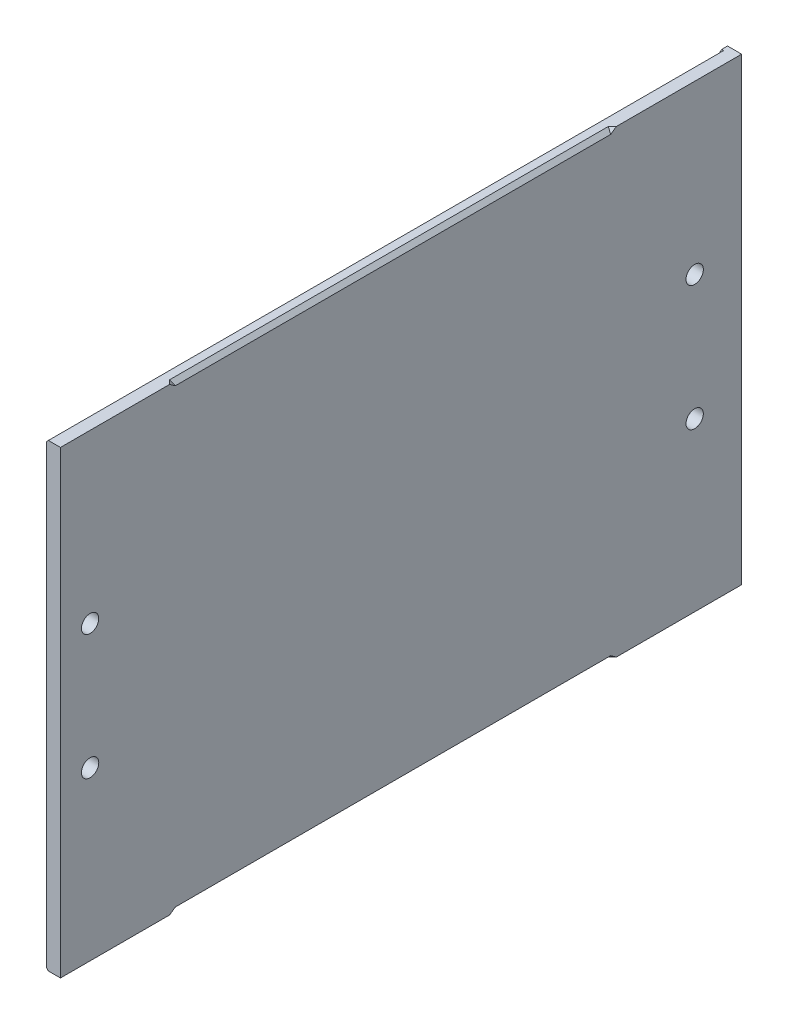
from build123d import *

# Parameters (mm, degrees)
SKETCH1_W                = 134
SKETCH1_H                = 57
BOSS_EXTRUDE1_DEPTH      = 250
SKETCH2_W                = 115
SKETCH2_H                = 53.5
CUT_EXTRUDE1_DEPTH       = 246.5
SKETCH3_W                = 115
SKETCH3_H                = 194
CUT_EXTRUDE2_DEPTH       = 3.5
SKETCH4_W                = 6
SKETCH4_H                = 120
CUT_EXTRUDE3_DEPTH       = 290.318163965
CHAMFER1_SIZE            = 6
SKETCH5_R                = 2.15
CUT_EXTRUDE4_DEPTH       = 134
SKETCH6_W                = 25
SKETCH6_H                = 4.5
BOSS_EXTRUDE2_DEPTH      = 115
SKETCH7_R                = 3.65
CUT_EXTRUDE5_DEPTH       = 3.6
CUT_EXTRUDE6_START       = -3.6
SKETCH8_R                = 3.65
CUT_EXTRUDE6_DEPTH       = 3.6
CHAMFER1_OF_MIRROR1_SIZE = 6
SKETCH9_R                = 1.65
CUT_EXTRUDE7_DEPTH       = 25
CHAMFER3_SIZE            = 0.5
CUT_EXTRUDE9_DEPTH       = 306.69919856
CHAMFER4_SIZE            = 0.5
SKETCH12_W               = 0.5
SKETCH12_H               = 2
BOSS_EXTRUDE3_DEPTH      = 114
CHAMFER5_SIZE            = 0.5


# Some blends are built 0.0001 mm under size
with BuildPart() as part:
    # Sketch1 → Boss-Extrude1 (new body)
    with BuildSketch(Plane.XY):
        with Locations((67, 28.5)):
            Rectangle(SKETCH1_W, SKETCH1_H)
    boss_extrude1 = extrude(amount=BOSS_EXTRUDE1_DEPTH)

    # Sketch2 → Cut-Extrude1 (cut)
    with BuildSketch(Plane.XY.offset(250)):
        with Locations((67, 26.75)):
            Rectangle(SKETCH2_W, SKETCH2_H)
    cut_extrude1 = extrude(amount=-CUT_EXTRUDE1_DEPTH, mode=Mode.SUBTRACT)

    # Sketch3 → Cut-Extrude2 (cut)
    with BuildSketch(Plane(origin=(0, 57, 0), x_dir=(1, 0, 0), z_dir=(0, 1, 0))):
        with Locations((67, -153)):
            Rectangle(SKETCH3_W, SKETCH3_H)
    cut_extrude2 = extrude(amount=-CUT_EXTRUDE2_DEPTH, mode=Mode.SUBTRACT)

    # Sketch4 → Cut-Extrude3 (cut, through all)
    with BuildSketch(Plane.XZ):
        with Locations((3, 142.5)):
            Rectangle(SKETCH4_W, SKETCH4_H)
        with Locations((131, 142.5)):
            Rectangle(SKETCH4_W, SKETCH4_H)
    cut_extrude3 = extrude(amount=-CUT_EXTRUDE3_DEPTH, mode=Mode.SUBTRACT)

    # Chamfer1
    chamfer1_edges = [part.edges().sort_by_distance(p)[0] for p in [
        (6, 28.5, 202.5),
        (6, 28.5, 82.5),
        (128, 28.5, 82.5),
        (128, 28.5, 202.5),
    ]]
    chamfer(chamfer1_edges, length=CHAMFER1_SIZE - 0.0001)  # a hair under: the kernel refuses the full size

    # Sketch5 → Cut-Extrude4 (cut)
    with BuildSketch(Plane(origin=(134, 0, 0), x_dir=(0, 0, -1), z_dir=(1, 0, 0))):
        with Locations((-217.65, 15.5)):
            Circle(SKETCH5_R)
        with Locations((-67.65, 15.5)):
            Circle(SKETCH5_R)
    cut_extrude4 = extrude(amount=-CUT_EXTRUDE4_DEPTH, mode=Mode.SUBTRACT)

    # Sketch6 → Boss-Extrude2 (add)
    with BuildSketch(Plane(origin=(9.5, 0, 0), x_dir=(0, 0, -1), z_dir=(1, 0, 0))):
        with Locations((-237.5, 2.25)):
            Rectangle(SKETCH6_W, SKETCH6_H)
    boss_extrude2 = extrude(amount=BOSS_EXTRUDE2_DEPTH)

    # Sketch7 → Cut-Extrude5 (cut)
    with BuildSketch(Plane(origin=(134, 0, 0), x_dir=(0, 0, -1), z_dir=(1, 0, 0))):
        with Locations((-217.65, 15.5)):
            Circle(SKETCH7_R)
        with Locations((-67.65, 15.5)):
            Circle(SKETCH7_R)
    cut_extrude5 = extrude(amount=-CUT_EXTRUDE5_DEPTH, mode=Mode.SUBTRACT)

    # Sketch8 → Cut-Extrude6 (cut)
    with BuildSketch(Plane.ZY.offset(CUT_EXTRUDE6_START)):
        with Locations(Location((217.65, 15.5, 0), (0, 0, 180))):
            Circle(SKETCH8_R)
        with Locations(Location((67.65, 15.5, 0), (0, 0, 180))):
            Circle(SKETCH8_R)
    cut_extrude6 = extrude(amount=CUT_EXTRUDE6_DEPTH, mode=Mode.SUBTRACT)


with BuildPart() as mirror1_1:
    # Mirror1: Boss-Extrude1 across plane
    add(boss_extrude1.mirror(Plane.ZX))

    # Mirror1 2: Cut-Extrude1, Cut-Extrude2, Cut-Extrude3, Cut-Extrude4 across plane
    add(cut_extrude1.mirror(Plane.ZX), mode=Mode.SUBTRACT)
    add(cut_extrude2.mirror(Plane.ZX), mode=Mode.SUBTRACT)
    add(cut_extrude3.mirror(Plane.ZX), mode=Mode.SUBTRACT)
    add(cut_extrude4.mirror(Plane.ZX), mode=Mode.SUBTRACT)

    # Mirror1 4: Cut-Extrude5, Cut-Extrude6 across plane
    add(cut_extrude5.mirror(Plane.ZX), mode=Mode.SUBTRACT)
    add(cut_extrude6.mirror(Plane.ZX), mode=Mode.SUBTRACT)

    # Chamfer1 of Mirror1
    chamfer1_of_mirror1_edges = [mirror1_1.edges().sort_by_distance(p)[0] for p in [
        (6, -28.5, 202.5),
        (6, -28.5, 82.5),
        (128, -28.5, 82.5),
        (128, -28.5, 202.5),
    ]]
    chamfer(chamfer1_of_mirror1_edges, length=CHAMFER1_OF_MIRROR1_SIZE - 0.0001)  # a hair under: the kernel refuses the full size


with BuildPart() as mirror1_3_1:
    # Mirror1 3: Boss-Extrude2 across plane
    add(boss_extrude2.mirror(Plane.ZX))


with BuildPart() as part_1:
    add(part.part)

    # Mirror1 united with what the copies touc: union Mirror1_1, Mirror1 3_1
    add(mirror1_1.part)
    add(mirror1_3_1.part)

    # Sketch9 → Cut-Extrude7 (cut)
    with BuildSketch(Plane.XY.offset(250)):
        with Locations((25, 0)):
            Circle(SKETCH9_R)
        with Locations((109, 0)):
            Circle(SKETCH9_R)
    extrude(amount=-CUT_EXTRUDE7_DEPTH, mode=Mode.SUBTRACT)

    # Chamfer2
    # the kernel refuses this chamfer: 1 mm, written as the material it takes off along each edge
    with BuildSketch(Plane(origin=(133.333333333, -56.333333333, 0.666666667), x_dir=(-0.7071067811865475, -0.7071067811865475, 0), z_dir=(0.5773502691896257, -0.5773502691896258, -0.5773502691896258))) as chamfer2_piece_1:
        Polygon((-0.707106781, -0.40824829), (0.707106781, -0.40824829), (0, 0.816496581), align=None)
    extrude(amount=1.270170592, mode=Mode.SUBTRACT)
    with BuildSketch(Plane(origin=(0.666666667, -56.333333333, 0.666666667), x_dir=(0.7071067811865475, -0.7071067811865475, 0), z_dir=(-0.5773502691896258, -0.5773502691896258, -0.5773502691896258)), Plane(origin=(133.333333333, 56.333333333, 0.666666667), x_dir=(-0.7071067811865475, 0.7071067811865475, 0), z_dir=(0.5773502691896257, 0.5773502691896258, -0.5773502691896258)), Plane(origin=(0.666666667, 56.333333333, 0.666666667), x_dir=(-0.7071067811865475, -0.7071067811865475, 0), z_dir=(-0.5773502691896257, 0.5773502691896258, -0.5773502691896257))) as chamfer2_piece_2:
        Polygon((-0.707106781, 0.40824829), (0.707106781, 0.40824829), (0, -0.816496581), align=None)
    extrude(amount=1.270170592, mode=Mode.SUBTRACT)
    with BuildSketch(Plane(origin=(0, -57, 199.928317012), x_dir=(0.9996219169112968, -0.02749587661058908, 0), z_dir=(0, 0, 1)), Plane(origin=(134, 57, 199.928317012), x_dir=(-0.9996219169112968, 0.027495876610589196, 0), z_dir=(0, 0, 1))) as chamfer2_piece_3:
        with BuildLine():
            Line((1.028673195, 0), (-0.056547155, 1.027117794))
            Line((-0.056547155, 1.027117794), (-0.076539593, 1.026567876))
            ThreePointArc((-0.076539593, 1.026567876), (-0.034129227, 0.51339783), (-0.019992438, -0.000549918))
            Line((-0.019992438, -0.000549918), (0.000549918, -0.019992438))
            ThreePointArc((0.000549918, -0.019992438), (0.514497665, -0.00585565), (1.029223113, -0.019992438))
            Line((1.029223113, -0.019992438), (1.028673195, 0))
        make_face()
    extrude(amount=52.643365976, mode=Mode.SUBTRACT)
    with BuildSketch(Plane(origin=(134, -57, 199.928317012), x_dir=(-0.9996219169112968, -0.027495876610589196, 0), z_dir=(0, 0, 1)), Plane(origin=(0, 57, 199.928317012), x_dir=(0.9996219169112968, 0.02749587661058908, 0), z_dir=(0, 0, 1))) as chamfer2_piece_4:
        with BuildLine():
            Line((1.028673195, 0), (-0.056547155, -1.027117794))
            Line((-0.056547155, -1.027117794), (-0.076539593, -1.026567876))
            ThreePointArc((-0.076539593, -1.026567876), (-0.034129227, -0.51339783), (-0.019992438, 0.000549918))
            Line((-0.019992438, 0.000549918), (0.000549918, 0.019992438))
            ThreePointArc((0.000549918, 0.019992438), (0.514497665, 0.00585565), (1.029223113, 0.019992438))
            Line((1.029223113, 0.019992438), (1.028673195, 0))
        make_face()
    extrude(amount=52.643365976, mode=Mode.SUBTRACT)
    with BuildSketch(Plane(origin=(136.571682988, -57, 0), x_dir=(0, -0.02749587661058908, 0.9996219169112968), z_dir=(-1, 0, 0))) as chamfer2_piece_5:
        with BuildLine():
            Line((1.028673195, 0), (-0.056547155, 1.027117794))
            Line((-0.056547155, 1.027117794), (-0.076539593, 1.026567876))
            ThreePointArc((-0.076539593, 1.026567876), (-0.034129227, 0.51339783), (-0.019992438, -0.000549918))
            Line((-0.019992438, -0.000549918), (0.000549918, -0.019992438))
            ThreePointArc((0.000549918, -0.019992438), (0.514497665, -0.00585565), (1.029223113, -0.019992438))
            Line((1.029223113, -0.019992438), (1.028673195, 0))
        make_face()
    extrude(amount=139.143365976, mode=Mode.SUBTRACT)
    with BuildSketch(Plane(origin=(134, -57, -2.571682988), x_dir=(0.027495876610582105, 0.999621916911297, 0), z_dir=(0, 0, 1)), Plane(origin=(0, -57, -2.571682988), x_dir=(0.9996219169112968, -0.02749587661058908, 0), z_dir=(0, 0, 1))) as chamfer2_piece_6:
        with BuildLine():
            Line((1.028673195, 0), (-0.056547155, 1.027117794))
            Line((-0.056547155, 1.027117794), (-0.076539593, 1.026567876))
            ThreePointArc((-0.076539593, 1.026567876), (-0.034129227, 0.51339783), (-0.019992438, -0.000549918))
            Line((-0.019992438, -0.000549918), (0.000549918, -0.019992438))
            ThreePointArc((0.000549918, -0.019992438), (0.514497665, -0.00585565), (1.029223113, -0.019992438))
            Line((1.029223113, -0.019992438), (1.028673195, 0))
        make_face()
    extrude(amount=87.643365976, mode=Mode.SUBTRACT)
    with BuildSketch(Plane(origin=(6, -57, 85.928217012), x_dir=(0.9996219169112968, -0.027495876610589075, 0), z_dir=(0, 0, 1))) as chamfer2_piece_7_section:
        with BuildLine():
            Line((1.028673195, 0), (-0.056547155, 1.027117794))
            Line((-0.056547155, 1.027117794), (-0.076539593, 1.026567876))
            ThreePointArc((-0.076539593, 1.026567876), (-0.034129227, 0.51339783), (-0.019992438, -0.000549918))
            Line((-0.019992438, -0.000549918), (0.000549918, -0.019992438))
            ThreePointArc((0.000549918, -0.019992438), (0.514497665, -0.00585565), (1.029223113, -0.019992438))
            Line((1.029223113, -0.019992438), (1.028673195, 0))
        make_face()
    chamfer2_piece_7 = extrude(amount=113.143565976, mode=Mode.PRIVATE)
    chamfer2_piece_7 = split(chamfer2_piece_7, bisect_by=Plane(origin=(33.164355215, -56.669573831, 115.664255215), z_dir=(-0.7071067811865475, 0, 0.7071067811865477)), keep=Keep.TOP, mode=Mode.PRIVATE)
    chamfer2_piece_7 = split(chamfer2_piece_7, bisect_by=Plane(origin=(33.164355215, -56.669573831, 169.335744785), z_dir=(-0.7071067811865472, 0, -0.7071067811865478)), keep=Keep.TOP, mode=Mode.PRIVATE)
    add(chamfer2_piece_7, mode=Mode.SUBTRACT)
    with BuildSketch(Plane(origin=(128, -57, 85.928217012), x_dir=(0.027495876610582105, 0.999621916911297, 0), z_dir=(0, 0, 1))) as chamfer2_piece_8_section:
        with BuildLine():
            Line((1.028673195, 0), (-0.056547155, 1.027117794))
            Line((-0.056547155, 1.027117794), (-0.076539593, 1.026567876))
            ThreePointArc((-0.076539593, 1.026567876), (-0.034129227, 0.51339783), (-0.019992438, -0.000549918))
            Line((-0.019992438, -0.000549918), (0.000549918, -0.019992438))
            ThreePointArc((0.000549918, -0.019992438), (0.514497665, -0.00585565), (1.029223113, -0.019992438))
            Line((1.029223113, -0.019992438), (1.028673195, 0))
        make_face()
    chamfer2_piece_8 = extrude(amount=113.143565976, mode=Mode.PRIVATE)
    chamfer2_piece_8 = split(chamfer2_piece_8, bisect_by=Plane(origin=(100.835644785, -56.669573831, 115.664255215), z_dir=(0.7071067811865476, 0, 0.7071067811865476)), keep=Keep.TOP, mode=Mode.PRIVATE)
    chamfer2_piece_8 = split(chamfer2_piece_8, bisect_by=Plane(origin=(100.835644785, -56.669573831, 169.335744785), z_dir=(0.7071067811865476, 0, -0.7071067811865476)), keep=Keep.TOP, mode=Mode.PRIVATE)
    add(chamfer2_piece_8, mode=Mode.SUBTRACT)
    with BuildSketch(Plane(origin=(-1.81835448, -57, 204.31845448), x_dir=(0.7068394360706731, -0.027495876610588672, 0.7068394360706738), z_dir=(0.7071067811865479, 0, -0.7071067811865474))) as chamfer2_piece_9_section:
        with BuildLine():
            Line((1.028673195, 0), (-0.056547155, -1.027117794))
            Line((-0.056547155, -1.027117794), (-0.076539593, -1.026567876))
            ThreePointArc((-0.076539593, -1.026567876), (-0.034129227, -0.51339783), (-0.019992438, 0.000549918))
            Line((-0.019992438, 0.000549918), (0.000549918, 0.019992438))
            ThreePointArc((0.000549918, 0.019992438), (0.514497665, 0.00585565), (1.029223113, 0.019992438))
            Line((1.029223113, 0.019992438), (1.028673195, 0))
        make_face()
    chamfer2_piece_9 = extrude(amount=13.628505929, mode=Mode.PRIVATE)
    chamfer2_piece_9 = split(chamfer2_piece_9, bisect_by=Plane(origin=(6, -56.681906875, 203.533564865), z_dir=(-1, 0, 0)), keep=Keep.TOP, mode=Mode.PRIVATE)
    add(chamfer2_piece_9, mode=Mode.SUBTRACT)
    with BuildSketch(Plane(origin=(7.81845448, -57, 90.31835448), x_dir=(0.7068394360706733, -0.027495876610588946, -0.7068394360706736), z_dir=(-0.7071067811865477, 0, -0.7071067811865475))) as chamfer2_piece_10_section:
        with BuildLine():
            Line((1.028673195, 0), (-0.056547155, -1.027117794))
            Line((-0.056547155, -1.027117794), (-0.076539593, -1.026567876))
            ThreePointArc((-0.076539593, -1.026567876), (-0.034129227, -0.51339783), (-0.019992438, 0.000549918))
            Line((-0.019992438, 0.000549918), (0.000549918, 0.019992438))
            ThreePointArc((0.000549918, 0.019992438), (0.514497665, 0.00585565), (1.029223113, 0.019992438))
            Line((1.029223113, 0.019992438), (1.028673195, 0))
        make_face()
    chamfer2_piece_10 = extrude(amount=13.628505929, mode=Mode.PRIVATE)
    chamfer2_piece_10 = split(chamfer2_piece_10, bisect_by=Plane(origin=(6, -56.661529994, 85.278226705), z_dir=(-1, 0, 0)), keep=Keep.TOP, mode=Mode.PRIVATE)
    add(chamfer2_piece_10, mode=Mode.SUBTRACT)
    with BuildSketch(Plane(origin=(135.81835448, -57, 80.68154552), x_dir=(0.01944252080601719, 0.9996219169112965, 0.01944252080601719), z_dir=(-0.7071067811865476, 0, 0.7071067811865476))) as chamfer2_piece_11_section:
        with BuildLine():
            Line((1.028673195, 0), (-0.056547155, 1.027117794))
            Line((-0.056547155, 1.027117794), (-0.076539593, 1.026567876))
            ThreePointArc((-0.076539593, 1.026567876), (-0.034129227, 0.51339783), (-0.019992438, -0.000549918))
            Line((-0.019992438, -0.000549918), (0.000549918, -0.019992438))
            ThreePointArc((0.000549918, -0.019992438), (0.514497665, -0.00585565), (1.029223113, -0.019992438))
            Line((1.029223113, -0.019992438), (1.028673195, 0))
        make_face()
    chamfer2_piece_11 = extrude(amount=13.628505929, mode=Mode.PRIVATE)
    chamfer2_piece_11 = split(chamfer2_piece_11, bisect_by=Plane(origin=(128, -56.681906875, 81.466435135), z_dir=(1, 0, 0)), keep=Keep.TOP, mode=Mode.PRIVATE)
    add(chamfer2_piece_11, mode=Mode.SUBTRACT)
    with BuildSketch(Plane(origin=(126.18154552, -57, 194.68164552), x_dir=(-0.7068394360706735, -0.027495876610588745, 0.7068394360706735), z_dir=(0.7071067811865476, 0, 0.7071067811865476))) as chamfer2_piece_12_section:
        with BuildLine():
            Line((1.028673195, 0), (-0.056547155, -1.027117794))
            Line((-0.056547155, -1.027117794), (-0.076539593, -1.026567876))
            ThreePointArc((-0.076539593, -1.026567876), (-0.034129227, -0.51339783), (-0.019992438, 0.000549918))
            Line((-0.019992438, 0.000549918), (0.000549918, 0.019992438))
            ThreePointArc((0.000549918, 0.019992438), (0.514497665, 0.00585565), (1.029223113, 0.019992438))
            Line((1.029223113, 0.019992438), (1.028673195, 0))
        make_face()
    chamfer2_piece_12 = extrude(amount=13.628505929, mode=Mode.PRIVATE)
    chamfer2_piece_12 = split(chamfer2_piece_12, bisect_by=Plane(origin=(128, -56.661529994, 199.721773295), z_dir=(1, 0, 0)), keep=Keep.TOP, mode=Mode.PRIVATE)
    add(chamfer2_piece_12, mode=Mode.SUBTRACT)
    with BuildSketch(Plane(origin=(134, 57, -2.571682988), x_dir=(0.027495876610582105, -0.999621916911297, 0), z_dir=(0, 0, 1)), Plane(origin=(0, 57, -2.571682988), x_dir=(0.9996219169112968, 0.02749587661058908, 0), z_dir=(0, 0, 1))) as chamfer2_piece_13:
        with BuildLine():
            Line((1.028673195, 0), (-0.056547155, -1.027117794))
            Line((-0.056547155, -1.027117794), (-0.076539593, -1.026567876))
            ThreePointArc((-0.076539593, -1.026567876), (-0.034129227, -0.51339783), (-0.019992438, 0.000549918))
            Line((-0.019992438, 0.000549918), (0.000549918, 0.019992438))
            ThreePointArc((0.000549918, 0.019992438), (0.514497665, 0.00585565), (1.029223113, 0.019992438))
            Line((1.029223113, 0.019992438), (1.028673195, 0))
        make_face()
    extrude(amount=87.643365976, mode=Mode.SUBTRACT)
    with BuildSketch(Plane(origin=(136.571682988, 57, 0), x_dir=(0, 0.02749587661058908, 0.9996219169112968), z_dir=(-1, 0, 0))) as chamfer2_piece_14:
        with BuildLine():
            Line((1.028673195, 0), (-0.056547155, -1.027117794))
            Line((-0.056547155, -1.027117794), (-0.076539593, -1.026567876))
            ThreePointArc((-0.076539593, -1.026567876), (-0.034129227, -0.51339783), (-0.019992438, 0.000549918))
            Line((-0.019992438, 0.000549918), (0.000549918, 0.019992438))
            ThreePointArc((0.000549918, 0.019992438), (0.514497665, 0.00585565), (1.029223113, 0.019992438))
            Line((1.029223113, 0.019992438), (1.028673195, 0))
        make_face()
    extrude(amount=139.143365976, mode=Mode.SUBTRACT)
    with BuildSketch(Plane(origin=(134, -59.571682988, 0), x_dir=(0.027495876610582174, 0, 0.9996219169112968), z_dir=(0, 1, 0)), Plane(origin=(0, -59.571682988, 0), x_dir=(0.9996219169112968, 0, -0.027495876610586372), z_dir=(0, 1, 0))) as chamfer2_piece_15:
        with BuildLine():
            Line((1.028673195, 0), (-0.056547155, -1.027117794))
            Line((-0.056547155, -1.027117794), (-0.076539593, -1.026567876))
            ThreePointArc((-0.076539593, -1.026567876), (-0.034129227, -0.51339783), (-0.019992438, 0.000549918))
            Line((-0.019992438, 0.000549918), (0.000549918, 0.019992438))
            ThreePointArc((0.000549918, 0.019992438), (0.514497665, 0.00585565), (1.029223113, 0.019992438))
            Line((1.029223113, 0.019992438), (1.028673195, 0))
        make_face()
    extrude(amount=119.143365976, mode=Mode.SUBTRACT)
    with BuildSketch(Plane(origin=(6, 57, 199.071782988), x_dir=(0.9996219169112968, 0.027495876610589075, 0), z_dir=(0, 0, -1))) as chamfer2_piece_16_section:
        with BuildLine():
            Line((1.028673195, 0), (-0.056547155, 1.027117794))
            Line((-0.056547155, 1.027117794), (-0.076539593, 1.026567876))
            ThreePointArc((-0.076539593, 1.026567876), (-0.034129227, 0.51339783), (-0.019992438, -0.000549918))
            Line((-0.019992438, -0.000549918), (0.000549918, -0.019992438))
            ThreePointArc((0.000549918, -0.019992438), (0.514497665, -0.00585565), (1.029223113, -0.019992438))
            Line((1.029223113, -0.019992438), (1.028673195, 0))
        make_face()
    chamfer2_piece_16 = extrude(amount=113.143565976, mode=Mode.PRIVATE)
    chamfer2_piece_16 = split(chamfer2_piece_16, bisect_by=Plane(origin=(33.164355215, 56.669573831, 115.664255215), z_dir=(-0.7071067811865475, 0, 0.7071067811865477)), keep=Keep.TOP, mode=Mode.PRIVATE)
    chamfer2_piece_16 = split(chamfer2_piece_16, bisect_by=Plane(origin=(33.164355215, 56.669573831, 169.335744785), z_dir=(-0.7071067811865472, 0, -0.7071067811865478)), keep=Keep.TOP, mode=Mode.PRIVATE)
    add(chamfer2_piece_16, mode=Mode.SUBTRACT)
    with BuildSketch(Plane(origin=(128, 57, 199.071782988), x_dir=(-0.9996219169112968, 0.027495876610589196, 0), z_dir=(0, 0, -1))) as chamfer2_piece_17_section:
        with BuildLine():
            Line((1.028673195, 0), (-0.056547155, -1.027117794))
            Line((-0.056547155, -1.027117794), (-0.076539593, -1.026567876))
            ThreePointArc((-0.076539593, -1.026567876), (-0.034129227, -0.51339783), (-0.019992438, 0.000549918))
            Line((-0.019992438, 0.000549918), (0.000549918, 0.019992438))
            ThreePointArc((0.000549918, 0.019992438), (0.514497665, 0.00585565), (1.029223113, 0.019992438))
            Line((1.029223113, 0.019992438), (1.028673195, 0))
        make_face()
    chamfer2_piece_17 = extrude(amount=113.143565976, mode=Mode.PRIVATE)
    chamfer2_piece_17 = split(chamfer2_piece_17, bisect_by=Plane(origin=(100.835644785, 56.669573831, 115.664255215), z_dir=(0.7071067811865476, 0, 0.7071067811865476)), keep=Keep.TOP, mode=Mode.PRIVATE)
    chamfer2_piece_17 = split(chamfer2_piece_17, bisect_by=Plane(origin=(100.835644785, 56.669573831, 169.335744785), z_dir=(0.7071067811865476, 0, -0.7071067811865476)), keep=Keep.TOP, mode=Mode.PRIVATE)
    add(chamfer2_piece_17, mode=Mode.SUBTRACT)
    with BuildSketch(Plane(origin=(-1.81835448, 57, 204.31845448), x_dir=(0.7068394360706731, 0.027495876610588672, 0.7068394360706738), z_dir=(0.7071067811865479, 0, -0.7071067811865474))) as chamfer2_piece_18_section:
        with BuildLine():
            Line((1.028673195, 0), (-0.056547155, 1.027117794))
            Line((-0.056547155, 1.027117794), (-0.076539593, 1.026567876))
            ThreePointArc((-0.076539593, 1.026567876), (-0.034129227, 0.51339783), (-0.019992438, -0.000549918))
            Line((-0.019992438, -0.000549918), (0.000549918, -0.019992438))
            ThreePointArc((0.000549918, -0.019992438), (0.514497665, -0.00585565), (1.029223113, -0.019992438))
            Line((1.029223113, -0.019992438), (1.028673195, 0))
        make_face()
    chamfer2_piece_18 = extrude(amount=13.628505929, mode=Mode.PRIVATE)
    chamfer2_piece_18 = split(chamfer2_piece_18, bisect_by=Plane(origin=(6, 56.681906875, 203.533564865), z_dir=(-1, 0, 0)), keep=Keep.TOP, mode=Mode.PRIVATE)
    add(chamfer2_piece_18, mode=Mode.SUBTRACT)
    with BuildSketch(Plane(origin=(7.81845448, 57, 90.31835448), x_dir=(0.7068394360706733, 0.027495876610588946, -0.7068394360706736), z_dir=(-0.7071067811865477, 0, -0.7071067811865475))) as chamfer2_piece_19_section:
        with BuildLine():
            Line((1.028673195, 0), (-0.056547155, 1.027117794))
            Line((-0.056547155, 1.027117794), (-0.076539593, 1.026567876))
            ThreePointArc((-0.076539593, 1.026567876), (-0.034129227, 0.51339783), (-0.019992438, -0.000549918))
            Line((-0.019992438, -0.000549918), (0.000549918, -0.019992438))
            ThreePointArc((0.000549918, -0.019992438), (0.514497665, -0.00585565), (1.029223113, -0.019992438))
            Line((1.029223113, -0.019992438), (1.028673195, 0))
        make_face()
    chamfer2_piece_19 = extrude(amount=13.628505929, mode=Mode.PRIVATE)
    chamfer2_piece_19 = split(chamfer2_piece_19, bisect_by=Plane(origin=(6, 56.661529994, 85.278226705), z_dir=(-1, 0, 0)), keep=Keep.TOP, mode=Mode.PRIVATE)
    add(chamfer2_piece_19, mode=Mode.SUBTRACT)
    with BuildSketch(Plane(origin=(135.81835448, 57, 80.68154552), x_dir=(0.01944252080601719, -0.9996219169112965, 0.01944252080601719), z_dir=(-0.7071067811865476, 0, 0.7071067811865476))) as chamfer2_piece_20_section:
        with BuildLine():
            Line((1.028673195, 0), (-0.056547155, -1.027117794))
            Line((-0.056547155, -1.027117794), (-0.076539593, -1.026567876))
            ThreePointArc((-0.076539593, -1.026567876), (-0.034129227, -0.51339783), (-0.019992438, 0.000549918))
            Line((-0.019992438, 0.000549918), (0.000549918, 0.019992438))
            ThreePointArc((0.000549918, 0.019992438), (0.514497665, 0.00585565), (1.029223113, 0.019992438))
            Line((1.029223113, 0.019992438), (1.028673195, 0))
        make_face()
    chamfer2_piece_20 = extrude(amount=13.628505929, mode=Mode.PRIVATE)
    chamfer2_piece_20 = split(chamfer2_piece_20, bisect_by=Plane(origin=(128, 56.681906875, 81.466435135), z_dir=(1, 0, 0)), keep=Keep.TOP, mode=Mode.PRIVATE)
    add(chamfer2_piece_20, mode=Mode.SUBTRACT)
    with BuildSketch(Plane(origin=(126.18154552, 57, 194.68164552), x_dir=(-0.7068394360706735, 0.027495876610588745, 0.7068394360706735), z_dir=(0.7071067811865476, 0, 0.7071067811865476))) as chamfer2_piece_21_section:
        with BuildLine():
            Line((1.028673195, 0), (-0.056547155, 1.027117794))
            Line((-0.056547155, 1.027117794), (-0.076539593, 1.026567876))
            ThreePointArc((-0.076539593, 1.026567876), (-0.034129227, 0.51339783), (-0.019992438, -0.000549918))
            Line((-0.019992438, -0.000549918), (0.000549918, -0.019992438))
            ThreePointArc((0.000549918, -0.019992438), (0.514497665, -0.00585565), (1.029223113, -0.019992438))
            Line((1.029223113, -0.019992438), (1.028673195, 0))
        make_face()
    chamfer2_piece_21 = extrude(amount=13.628505929, mode=Mode.PRIVATE)
    chamfer2_piece_21 = split(chamfer2_piece_21, bisect_by=Plane(origin=(128, 56.661529994, 199.721773295), z_dir=(1, 0, 0)), keep=Keep.TOP, mode=Mode.PRIVATE)
    add(chamfer2_piece_21, mode=Mode.SUBTRACT)
    with BuildSketch(Plane(origin=(7.81845448, -57, 90.31835448), x_dir=(0.7068394360706733, -0.027495876610588946, -0.7068394360706736), z_dir=(-0.7071067811865477, 0, -0.7071067811865475))) as chamfer2_piece_22a_section:
        with BuildLine():
            Line((1.028673195, 0), (-0.056547155, -1.027117794))
            Line((-0.056547155, -1.027117794), (-0.076539593, -1.026567876))
            ThreePointArc((-0.076539593, -1.026567876), (-0.034129227, -0.51339783), (-0.019992438, 0.000549918))
            Line((-0.019992438, 0.000549918), (0.000549918, 0.019992438))
            ThreePointArc((0.000549918, 0.019992438), (0.514497665, 0.00585565), (1.029223113, 0.019992438))
            Line((1.029223113, 0.019992438), (1.028673195, 0))
        make_face()
    chamfer2_piece_22a = extrude(amount=13.628505929, mode=Mode.PRIVATE)
    chamfer2_piece_22a = split(chamfer2_piece_22a, bisect_by=Plane(origin=(6, -56.681906875, 89.036114365), z_dir=(1, 0, 0)), keep=Keep.TOP, mode=Mode.PRIVATE)
    with BuildSketch(Plane(origin=(6, -57, 85.928217012), x_dir=(0.9996219169112968, -0.027495876610589075, 0), z_dir=(0, 0, 1))) as chamfer2_piece_22b_section:
        with BuildLine():
            Line((1.028673195, 0), (-0.056547155, 1.027117794))
            Line((-0.056547155, 1.027117794), (-0.076539593, 1.026567876))
            ThreePointArc((-0.076539593, 1.026567876), (-0.034129227, 0.51339783), (-0.019992438, -0.000549918))
            Line((-0.019992438, -0.000549918), (0.000549918, -0.019992438))
            ThreePointArc((0.000549918, -0.019992438), (0.514497665, -0.00585565), (1.029223113, -0.019992438))
            Line((1.029223113, -0.019992438), (1.028673195, 0))
        make_face()
    chamfer2_piece_22b = extrude(amount=113.143565976, mode=Mode.PRIVATE)
    chamfer2_piece_22b = split(chamfer2_piece_22b, bisect_by=Plane(origin=(5.620839187, -56.681906875, 88.120739187), z_dir=(0.7071067811865475, 0, -0.7071067811865477)), keep=Keep.TOP, mode=Mode.PRIVATE)
    chamfer2_piece_22 = chamfer2_piece_22a & chamfer2_piece_22b
    add(chamfer2_piece_22, mode=Mode.SUBTRACT)
    with BuildSketch(Plane(origin=(6, -57, 85.928217012), x_dir=(0.9996219169112968, -0.027495876610589075, 0), z_dir=(0, 0, 1))) as chamfer2_piece_23a_section:
        with BuildLine():
            Line((1.028673195, 0), (-0.056547155, 1.027117794))
            Line((-0.056547155, 1.027117794), (-0.076539593, 1.026567876))
            ThreePointArc((-0.076539593, 1.026567876), (-0.034129227, 0.51339783), (-0.019992438, -0.000549918))
            Line((-0.019992438, -0.000549918), (0.000549918, -0.019992438))
            ThreePointArc((0.000549918, -0.019992438), (0.514497665, -0.00585565), (1.029223113, -0.019992438))
            Line((1.029223113, -0.019992438), (1.028673195, 0))
        make_face()
    chamfer2_piece_23a = extrude(amount=113.143565976, mode=Mode.PRIVATE)
    chamfer2_piece_23a = split(chamfer2_piece_23a, bisect_by=Plane(origin=(5.620839187, -56.681906875, 196.879260813), z_dir=(0.7071067811865472, 0, 0.7071067811865478)), keep=Keep.TOP, mode=Mode.PRIVATE)
    with BuildSketch(Plane(origin=(-1.81835448, -57, 204.31845448), x_dir=(0.7068394360706731, -0.027495876610588672, 0.7068394360706738), z_dir=(0.7071067811865479, 0, -0.7071067811865474))) as chamfer2_piece_23b_section:
        with BuildLine():
            Line((1.028673195, 0), (-0.056547155, -1.027117794))
            Line((-0.056547155, -1.027117794), (-0.076539593, -1.026567876))
            ThreePointArc((-0.076539593, -1.026567876), (-0.034129227, -0.51339783), (-0.019992438, 0.000549918))
            Line((-0.019992438, 0.000549918), (0.000549918, 0.019992438))
            ThreePointArc((0.000549918, 0.019992438), (0.514497665, 0.00585565), (1.029223113, 0.019992438))
            Line((1.029223113, 0.019992438), (1.028673195, 0))
        make_face()
    chamfer2_piece_23b = extrude(amount=13.628505929, mode=Mode.PRIVATE)
    chamfer2_piece_23b = split(chamfer2_piece_23b, bisect_by=Plane(origin=(6, -56.681906875, 195.963885635), z_dir=(1, 0, 0)), keep=Keep.TOP, mode=Mode.PRIVATE)
    chamfer2_piece_23 = chamfer2_piece_23a & chamfer2_piece_23b
    add(chamfer2_piece_23, mode=Mode.SUBTRACT)
    with BuildSketch(Plane(origin=(135.81835448, -57, 80.68154552), x_dir=(0.01944252080601719, 0.9996219169112965, 0.01944252080601719), z_dir=(-0.7071067811865476, 0, 0.7071067811865476))) as chamfer2_piece_24a_section:
        with BuildLine():
            Line((1.028673195, 0), (-0.056547155, 1.027117794))
            Line((-0.056547155, 1.027117794), (-0.076539593, 1.026567876))
            ThreePointArc((-0.076539593, 1.026567876), (-0.034129227, 0.51339783), (-0.019992438, -0.000549918))
            Line((-0.019992438, -0.000549918), (0.000549918, -0.019992438))
            ThreePointArc((0.000549918, -0.019992438), (0.514497665, -0.00585565), (1.029223113, -0.019992438))
            Line((1.029223113, -0.019992438), (1.028673195, 0))
        make_face()
    chamfer2_piece_24a = extrude(amount=13.628505929, mode=Mode.PRIVATE)
    chamfer2_piece_24a = split(chamfer2_piece_24a, bisect_by=Plane(origin=(128, -56.681906875, 89.036114365), z_dir=(-1, 0, 0)), keep=Keep.TOP, mode=Mode.PRIVATE)
    with BuildSketch(Plane(origin=(128, -57, 85.928217012), x_dir=(0.027495876610582105, 0.999621916911297, 0), z_dir=(0, 0, 1))) as chamfer2_piece_24b_section:
        with BuildLine():
            Line((1.028673195, 0), (-0.056547155, 1.027117794))
            Line((-0.056547155, 1.027117794), (-0.076539593, 1.026567876))
            ThreePointArc((-0.076539593, 1.026567876), (-0.034129227, 0.51339783), (-0.019992438, -0.000549918))
            Line((-0.019992438, -0.000549918), (0.000549918, -0.019992438))
            ThreePointArc((0.000549918, -0.019992438), (0.514497665, -0.00585565), (1.029223113, -0.019992438))
            Line((1.029223113, -0.019992438), (1.028673195, 0))
        make_face()
    chamfer2_piece_24b = extrude(amount=113.143565976, mode=Mode.PRIVATE)
    chamfer2_piece_24b = split(chamfer2_piece_24b, bisect_by=Plane(origin=(128.379160813, -56.681906875, 88.120739187), z_dir=(-0.7071067811865476, 0, -0.7071067811865476)), keep=Keep.TOP, mode=Mode.PRIVATE)
    chamfer2_piece_24 = chamfer2_piece_24a & chamfer2_piece_24b
    add(chamfer2_piece_24, mode=Mode.SUBTRACT)
    with BuildSketch(Plane(origin=(128, -57, 85.928217012), x_dir=(0.027495876610582105, 0.999621916911297, 0), z_dir=(0, 0, 1))) as chamfer2_piece_25a_section:
        with BuildLine():
            Line((1.028673195, 0), (-0.056547155, 1.027117794))
            Line((-0.056547155, 1.027117794), (-0.076539593, 1.026567876))
            ThreePointArc((-0.076539593, 1.026567876), (-0.034129227, 0.51339783), (-0.019992438, -0.000549918))
            Line((-0.019992438, -0.000549918), (0.000549918, -0.019992438))
            ThreePointArc((0.000549918, -0.019992438), (0.514497665, -0.00585565), (1.029223113, -0.019992438))
            Line((1.029223113, -0.019992438), (1.028673195, 0))
        make_face()
    chamfer2_piece_25a = extrude(amount=113.143565976, mode=Mode.PRIVATE)
    chamfer2_piece_25a = split(chamfer2_piece_25a, bisect_by=Plane(origin=(128.379160813, -56.681906875, 196.879260813), z_dir=(-0.7071067811865476, 0, 0.7071067811865476)), keep=Keep.TOP, mode=Mode.PRIVATE)
    with BuildSketch(Plane(origin=(126.18154552, -57, 194.68164552), x_dir=(-0.7068394360706735, -0.027495876610588745, 0.7068394360706735), z_dir=(0.7071067811865476, 0, 0.7071067811865476))) as chamfer2_piece_25b_section:
        with BuildLine():
            Line((1.028673195, 0), (-0.056547155, -1.027117794))
            Line((-0.056547155, -1.027117794), (-0.076539593, -1.026567876))
            ThreePointArc((-0.076539593, -1.026567876), (-0.034129227, -0.51339783), (-0.019992438, 0.000549918))
            Line((-0.019992438, 0.000549918), (0.000549918, 0.019992438))
            ThreePointArc((0.000549918, 0.019992438), (0.514497665, 0.00585565), (1.029223113, 0.019992438))
            Line((1.029223113, 0.019992438), (1.028673195, 0))
        make_face()
    chamfer2_piece_25b = extrude(amount=13.628505929, mode=Mode.PRIVATE)
    chamfer2_piece_25b = split(chamfer2_piece_25b, bisect_by=Plane(origin=(128, -56.681906875, 195.963885635), z_dir=(-1, 0, 0)), keep=Keep.TOP, mode=Mode.PRIVATE)
    chamfer2_piece_25 = chamfer2_piece_25a & chamfer2_piece_25b
    add(chamfer2_piece_25, mode=Mode.SUBTRACT)
    with BuildSketch(Plane(origin=(6, 57, 199.071782988), x_dir=(0.9996219169112968, 0.027495876610589075, 0), z_dir=(0, 0, -1))) as chamfer2_piece_26a_section:
        with BuildLine():
            Line((1.028673195, 0), (-0.056547155, 1.027117794))
            Line((-0.056547155, 1.027117794), (-0.076539593, 1.026567876))
            ThreePointArc((-0.076539593, 1.026567876), (-0.034129227, 0.51339783), (-0.019992438, -0.000549918))
            Line((-0.019992438, -0.000549918), (0.000549918, -0.019992438))
            ThreePointArc((0.000549918, -0.019992438), (0.514497665, -0.00585565), (1.029223113, -0.019992438))
            Line((1.029223113, -0.019992438), (1.028673195, 0))
        make_face()
    chamfer2_piece_26a = extrude(amount=113.143565976, mode=Mode.PRIVATE)
    chamfer2_piece_26a = split(chamfer2_piece_26a, bisect_by=Plane(origin=(5.620839187, 56.681906875, 196.879260813), z_dir=(0.7071067811865472, 0, 0.7071067811865478)), keep=Keep.TOP, mode=Mode.PRIVATE)
    with BuildSketch(Plane(origin=(-1.81835448, 57, 204.31845448), x_dir=(0.7068394360706731, 0.027495876610588672, 0.7068394360706738), z_dir=(0.7071067811865479, 0, -0.7071067811865474))) as chamfer2_piece_26b_section:
        with BuildLine():
            Line((1.028673195, 0), (-0.056547155, 1.027117794))
            Line((-0.056547155, 1.027117794), (-0.076539593, 1.026567876))
            ThreePointArc((-0.076539593, 1.026567876), (-0.034129227, 0.51339783), (-0.019992438, -0.000549918))
            Line((-0.019992438, -0.000549918), (0.000549918, -0.019992438))
            ThreePointArc((0.000549918, -0.019992438), (0.514497665, -0.00585565), (1.029223113, -0.019992438))
            Line((1.029223113, -0.019992438), (1.028673195, 0))
        make_face()
    chamfer2_piece_26b = extrude(amount=13.628505929, mode=Mode.PRIVATE)
    chamfer2_piece_26b = split(chamfer2_piece_26b, bisect_by=Plane(origin=(6, 56.681906875, 195.963885635), z_dir=(1, 0, 0)), keep=Keep.TOP, mode=Mode.PRIVATE)
    chamfer2_piece_26 = chamfer2_piece_26a & chamfer2_piece_26b
    add(chamfer2_piece_26, mode=Mode.SUBTRACT)
    with BuildSketch(Plane(origin=(7.81845448, 57, 90.31835448), x_dir=(0.7068394360706733, 0.027495876610588946, -0.7068394360706736), z_dir=(-0.7071067811865477, 0, -0.7071067811865475))) as chamfer2_piece_27a_section:
        with BuildLine():
            Line((1.028673195, 0), (-0.056547155, 1.027117794))
            Line((-0.056547155, 1.027117794), (-0.076539593, 1.026567876))
            ThreePointArc((-0.076539593, 1.026567876), (-0.034129227, 0.51339783), (-0.019992438, -0.000549918))
            Line((-0.019992438, -0.000549918), (0.000549918, -0.019992438))
            ThreePointArc((0.000549918, -0.019992438), (0.514497665, -0.00585565), (1.029223113, -0.019992438))
            Line((1.029223113, -0.019992438), (1.028673195, 0))
        make_face()
    chamfer2_piece_27a = extrude(amount=13.628505929, mode=Mode.PRIVATE)
    chamfer2_piece_27a = split(chamfer2_piece_27a, bisect_by=Plane(origin=(6, 56.681906875, 89.036114365), z_dir=(1, 0, 0)), keep=Keep.TOP, mode=Mode.PRIVATE)
    with BuildSketch(Plane(origin=(6, 57, 199.071782988), x_dir=(0.9996219169112968, 0.027495876610589075, 0), z_dir=(0, 0, -1))) as chamfer2_piece_27b_section:
        with BuildLine():
            Line((1.028673195, 0), (-0.056547155, 1.027117794))
            Line((-0.056547155, 1.027117794), (-0.076539593, 1.026567876))
            ThreePointArc((-0.076539593, 1.026567876), (-0.034129227, 0.51339783), (-0.019992438, -0.000549918))
            Line((-0.019992438, -0.000549918), (0.000549918, -0.019992438))
            ThreePointArc((0.000549918, -0.019992438), (0.514497665, -0.00585565), (1.029223113, -0.019992438))
            Line((1.029223113, -0.019992438), (1.028673195, 0))
        make_face()
    chamfer2_piece_27b = extrude(amount=113.143565976, mode=Mode.PRIVATE)
    chamfer2_piece_27b = split(chamfer2_piece_27b, bisect_by=Plane(origin=(5.620839187, 56.681906875, 88.120739187), z_dir=(0.7071067811865475, 0, -0.7071067811865477)), keep=Keep.TOP, mode=Mode.PRIVATE)
    chamfer2_piece_27 = chamfer2_piece_27a & chamfer2_piece_27b
    add(chamfer2_piece_27, mode=Mode.SUBTRACT)
    with BuildSketch(Plane(origin=(128, 57, 199.071782988), x_dir=(-0.9996219169112968, 0.027495876610589196, 0), z_dir=(0, 0, -1))) as chamfer2_piece_28a_section:
        with BuildLine():
            Line((1.028673195, 0), (-0.056547155, -1.027117794))
            Line((-0.056547155, -1.027117794), (-0.076539593, -1.026567876))
            ThreePointArc((-0.076539593, -1.026567876), (-0.034129227, -0.51339783), (-0.019992438, 0.000549918))
            Line((-0.019992438, 0.000549918), (0.000549918, 0.019992438))
            ThreePointArc((0.000549918, 0.019992438), (0.514497665, 0.00585565), (1.029223113, 0.019992438))
            Line((1.029223113, 0.019992438), (1.028673195, 0))
        make_face()
    chamfer2_piece_28a = extrude(amount=113.143565976, mode=Mode.PRIVATE)
    chamfer2_piece_28a = split(chamfer2_piece_28a, bisect_by=Plane(origin=(128.379160813, 56.681906875, 196.879260813), z_dir=(-0.7071067811865476, 0, 0.7071067811865476)), keep=Keep.TOP, mode=Mode.PRIVATE)
    with BuildSketch(Plane(origin=(126.18154552, 57, 194.68164552), x_dir=(-0.7068394360706735, 0.027495876610588745, 0.7068394360706735), z_dir=(0.7071067811865476, 0, 0.7071067811865476))) as chamfer2_piece_28b_section:
        with BuildLine():
            Line((1.028673195, 0), (-0.056547155, 1.027117794))
            Line((-0.056547155, 1.027117794), (-0.076539593, 1.026567876))
            ThreePointArc((-0.076539593, 1.026567876), (-0.034129227, 0.51339783), (-0.019992438, -0.000549918))
            Line((-0.019992438, -0.000549918), (0.000549918, -0.019992438))
            ThreePointArc((0.000549918, -0.019992438), (0.514497665, -0.00585565), (1.029223113, -0.019992438))
            Line((1.029223113, -0.019992438), (1.028673195, 0))
        make_face()
    chamfer2_piece_28b = extrude(amount=13.628505929, mode=Mode.PRIVATE)
    chamfer2_piece_28b = split(chamfer2_piece_28b, bisect_by=Plane(origin=(128, 56.681906875, 195.963885635), z_dir=(-1, 0, 0)), keep=Keep.TOP, mode=Mode.PRIVATE)
    chamfer2_piece_28 = chamfer2_piece_28a & chamfer2_piece_28b
    add(chamfer2_piece_28, mode=Mode.SUBTRACT)
    with BuildSketch(Plane(origin=(135.81835448, 57, 80.68154552), x_dir=(0.01944252080601719, -0.9996219169112965, 0.01944252080601719), z_dir=(-0.7071067811865476, 0, 0.7071067811865476))) as chamfer2_piece_29a_section:
        with BuildLine():
            Line((1.028673195, 0), (-0.056547155, -1.027117794))
            Line((-0.056547155, -1.027117794), (-0.076539593, -1.026567876))
            ThreePointArc((-0.076539593, -1.026567876), (-0.034129227, -0.51339783), (-0.019992438, 0.000549918))
            Line((-0.019992438, 0.000549918), (0.000549918, 0.019992438))
            ThreePointArc((0.000549918, 0.019992438), (0.514497665, 0.00585565), (1.029223113, 0.019992438))
            Line((1.029223113, 0.019992438), (1.028673195, 0))
        make_face()
    chamfer2_piece_29a = extrude(amount=13.628505929, mode=Mode.PRIVATE)
    chamfer2_piece_29a = split(chamfer2_piece_29a, bisect_by=Plane(origin=(128, 56.681906875, 89.036114365), z_dir=(-1, 0, 0)), keep=Keep.TOP, mode=Mode.PRIVATE)
    with BuildSketch(Plane(origin=(128, 57, 199.071782988), x_dir=(-0.9996219169112968, 0.027495876610589196, 0), z_dir=(0, 0, -1))) as chamfer2_piece_29b_section:
        with BuildLine():
            Line((1.028673195, 0), (-0.056547155, -1.027117794))
            Line((-0.056547155, -1.027117794), (-0.076539593, -1.026567876))
            ThreePointArc((-0.076539593, -1.026567876), (-0.034129227, -0.51339783), (-0.019992438, 0.000549918))
            Line((-0.019992438, 0.000549918), (0.000549918, 0.019992438))
            ThreePointArc((0.000549918, 0.019992438), (0.514497665, 0.00585565), (1.029223113, 0.019992438))
            Line((1.029223113, 0.019992438), (1.028673195, 0))
        make_face()
    chamfer2_piece_29b = extrude(amount=113.143565976, mode=Mode.PRIVATE)
    chamfer2_piece_29b = split(chamfer2_piece_29b, bisect_by=Plane(origin=(128.379160813, 56.681906875, 88.120739187), z_dir=(-0.7071067811865476, 0, -0.7071067811865476)), keep=Keep.TOP, mode=Mode.PRIVATE)
    chamfer2_piece_29 = chamfer2_piece_29a & chamfer2_piece_29b
    add(chamfer2_piece_29, mode=Mode.SUBTRACT)

    # Chamfer3
    chamfer3_edges = [part_1.edges().sort_by_distance(p)[0] for p in [
        (134, 15.5, 221.3),
        (134, 15.5, 71.3),
        (0, 15.5, 221.3),
        (0, 15.5, 71.3),
        (134, -15.5, 221.3),
        (134, -15.5, 71.3),
        (0, -15.5, 221.3),
        (0, -15.5, 71.3),
    ]]
    chamfer(chamfer3_edges, length=CHAMFER3_SIZE)

    # Sketch11 → Cut-Extrude9 (cut, through all)
    with BuildSketch(Plane(origin=(0, 57, 0), x_dir=(1, 0, 0), z_dir=(0, 1, 0))):
        Polygon((128, -88.5), (128, -56), (124.5, -56), (124.5, -225), (128, -225), (128, -196.5), (134, -196.5), (134, -250), (0, -250), (0, 0), (134, 0), (134, -88.5), align=None)
    extrude(amount=-CUT_EXTRUDE9_DEPTH, mode=Mode.SUBTRACT)

    # Chamfer4
    chamfer4_edges = [part_1.edges().sort_by_distance(p)[0] for p in [
        (124.5, 57, 140.5),
        (124.5, -57, 140.5),
    ]]
    chamfer(chamfer4_edges, length=CHAMFER4_SIZE)

    # Sketch12 → Boss-Extrude3 (add)
    with BuildSketch(Plane(origin=(0, 57, 0), x_dir=(1, 0, 0), z_dir=(0, 1, 0))):
        with Locations((124.75, -57)):
            Rectangle(SKETCH12_W, SKETCH12_H)
    extrude(amount=-BOSS_EXTRUDE3_DEPTH)

    # Chamfer5
    chamfer5_edges = [part_1.edges().sort_by_distance(p)[0] for p in [
        (124.75, 57, 58),
        (124.75, -57, 58),
    ]]
    chamfer(chamfer5_edges, length=CHAMFER5_SIZE - 0.0001)  # a hair under: the kernel refuses the full size


solid = part_1.part
